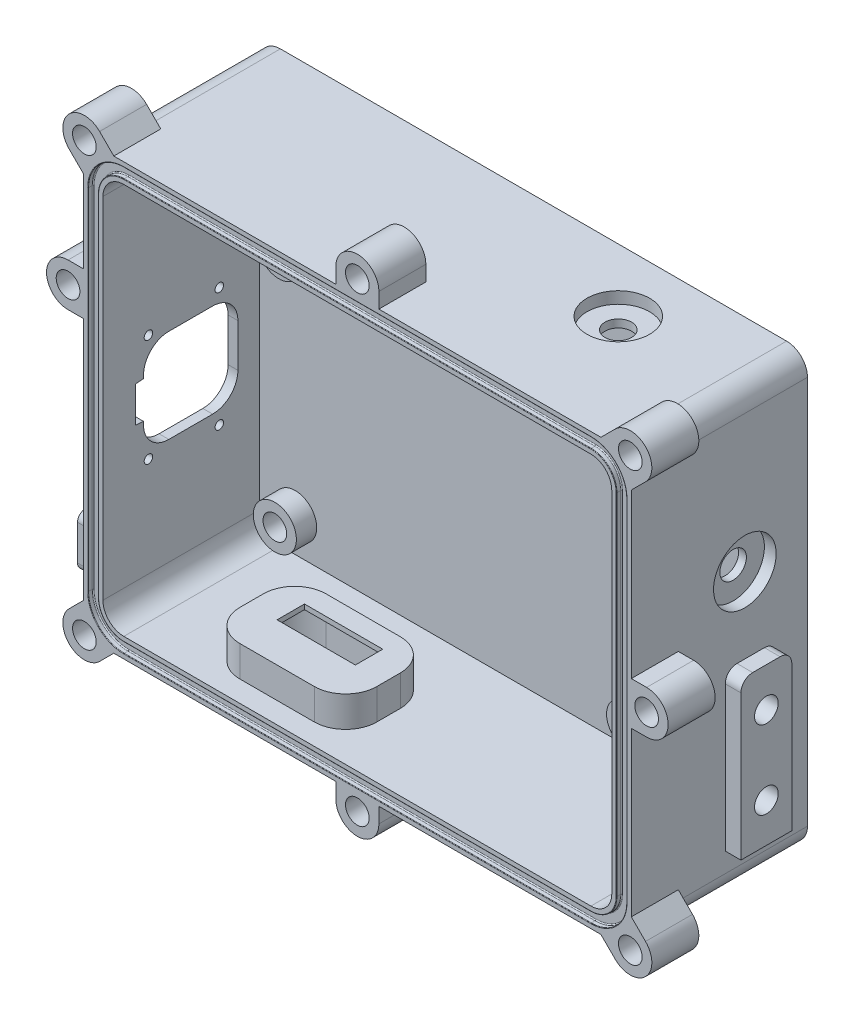
from build123d import *

# Parameters (mm, degrees)
SKETCH1_W               = 130
SKETCH1_H               = 100
BOSS_EXTRUDE1_DEPTH     = 40
SHELL1_T                = 5
FILLET1_R               = 5.334
FILLET2_R               = 5.334
CUT_EXTRUDE1_DEPTH      = 1.2954
FILLET3_R               = 0.254
FILLET4_R               = 0.127
BOSS_EXTRUDE2_START     = -12
BOSS_EXTRUDE2_DEPTH     = 12
SKETCH4_R               = 3.025
CUT_EXTRUDE2_DEPTH      = 9
MIRROR2_START           = -12
MIRROR2_COPY_1_DEPTH    = 12
MIRROR2_COPY_2_SKETCH_R = 3.025
MIRROR2_COPY_2_DEPTH    = 9
BOSS_EXTRUDE4_DEPTH     = 12
SKETCH8_R               = 3.025
CUT_EXTRUDE4_DEPTH      = 9
SKETCH9_R               = 5.5
SKETCH9_R_2             = 3.025
BOSS_EXTRUDE5_DEPTH     = 5.2
BOSS_EXTRUDE6_START     = -12
BOSS_EXTRUDE6_DEPTH     = 12
SKETCH11_R              = 3.025
CUT_EXTRUDE5_DEPTH      = 9
BOSS_EXTRUDE7_DEPTH     = 4
CUT_EXTRUDE6_START      = -6.5
SKETCH13_R              = 3.025
CUT_EXTRUDE6_DEPTH      = 6.5
FILLET5_R               = 2
FILLET6_R               = 3
SKETCH14_W              = 13
SKETCH14_H              = 40
SKETCH14_R              = 3.025
BOSS_EXTRUDE8_DEPTH     = 4
CUT_EXTRUDE7_START      = -6.5
SKETCH15_R              = 3.025
CUT_EXTRUDE7_DEPTH      = 6.5
FILLET7_R               = 3
SKETCH16_R              = 3.4
CUT_EXTRUDE8_DEPTH      = 5
SKETCH17_R              = 8
CUT_EXTRUDE9_DEPTH      = 3
SKETCH18_R              = 3.4
CUT_EXTRUDE10_DEPTH     = 5
SKETCH19_R              = 8
CUT_EXTRUDE11_DEPTH     = 3
SKETCH20_W              = 20
SKETCH20_H              = 7
CUT_EXTRUDE12_DEPTH     = 5
SKETCH21_W              = 35
SKETCH21_H              = 22
BOSS_EXTRUDE9_DEPTH     = 12.85
SKETCH22_W              = 32.5
SKETCH22_H              = 19.5
SKETCH22_W_2            = 20
SKETCH22_H_2            = 7
CUT_EXTRUDE14_DEPTH     = 11.6
SKETCH24_R              = 1.085
CUT_EXTRUDE16_DEPTH     = 5
CUT_EXTRUDE17_DEPTH     = 2.5
FILLET8_R               = 8
FILLET9_R               = 8


# Read off the part's stored shape, not the designer's step: Boss-Extrude6
with BuildPart() as part:
    # Sketch1 → Boss-Extrude1 (new body)
    with BuildSketch(Plane.XY):
        Rectangle(SKETCH1_W, SKETCH1_H)
    extrude(amount=BOSS_EXTRUDE1_DEPTH)

    # Shell1
    shell1_openings = [part.faces().sort_by_distance(p)[0] for p in [
        (0, 0, 40),
    ]]
    offset(amount=SHELL1_T, openings=shell1_openings, kind=Kind.INTERSECTION)

    # Fillet1
    # the kernel refuses this fillet: 5.334 mm, written as the material it adds along each edge
    with BuildSketch(Plane(origin=(65, -50, 0), x_dir=(0, 1, 0), z_dir=(0, 0, 1)), Plane(origin=(65, 50, 0), x_dir=(-1, 0, 0), z_dir=(0, 0, 1)), Plane(origin=(-65, -50, 0), x_dir=(1, 0, 0), z_dir=(0, 0, 1))) as fillet1_piece_1:
        with BuildLine():
            CenterArc((FILLET1_R, FILLET1_R), FILLET1_R, 180, 90)
            Line((0, FILLET1_R), (0, 0))
            Line((0, 0), (FILLET1_R, 0))
        make_face()
    extrude(amount=40)
    with BuildSketch(Plane(origin=(-65, 50, 0), x_dir=(1, 0, 0), z_dir=(0, 0, 1))) as fillet1_piece_2:
        with BuildLine():
            CenterArc((FILLET1_R, -FILLET1_R), FILLET1_R, 90, 90)
            Line((0, -FILLET1_R), (0, 0))
            Line((0, 0), (FILLET1_R, 0))
        make_face()
    extrude(amount=40)

    # Fillet2
    fillet2_edges = [part.edges().sort_by_distance(p)[0] for p in [
        (70, -55, 17.5),
        (-70, -55, 17.5),
        (-70, 55, 17.5),
        (70, 55, 17.5),
    ]]
    fillet(fillet2_edges, radius=FILLET2_R)

    # Sketch2 → Cut-Extrude1 (cut)
    with BuildSketch(Plane.XY.offset(40)):
        with BuildLine():
            Line((59.666, 53.7827), (-59.666, 53.7827))
            ThreePointArc((-59.666, 53.7827), (-66.112480392, 51.112480392), (-68.7827, 44.666))
            Line((-68.7827, 44.666), (-68.7827, -44.666))
            ThreePointArc((-68.7827, -44.666), (-66.112480392, -51.112480392), (-59.666, -53.7827))
            Line((-59.666, -53.7827), (59.666, -53.7827))
            ThreePointArc((59.666, -53.7827), (66.112480392, -51.112480392), (68.7827, -44.666))
            Line((68.7827, -44.666), (68.7827, 44.666))
            ThreePointArc((68.7827, 44.666), (66.112480392, 51.112480392), (59.666, 53.7827))
        make_face()
        with BuildLine():
            Line((-66.2173, 44.666), (-66.2173, -44.666))
            ThreePointArc((-66.2173, -44.666), (-64.298468656, -49.298468656), (-59.666, -51.2173))
            Line((-59.666, -51.2173), (59.666, -51.2173))
            ThreePointArc((59.666, -51.2173), (64.298468656, -49.298468656), (66.2173, -44.666))
            Line((66.2173, -44.666), (66.2173, 44.666))
            ThreePointArc((66.2173, 44.666), (64.298468656, 49.298468656), (59.666, 51.2173))
            Line((59.666, 51.2173), (-59.666, 51.2173))
            ThreePointArc((-59.666, 51.2173), (-64.298468656, 49.298468656), (-66.2173, 44.666))
        make_face(mode=Mode.SUBTRACT)
    extrude(amount=-CUT_EXTRUDE1_DEPTH, mode=Mode.SUBTRACT)

    # Fillet3
    fillet3_edges = [part.edges().sort_by_distance(p)[0] for p in [
        (66.112480392, 51.112480392, 38.7046),
        (68.7827, 0, 38.7046),
        (66.112480392, -51.112480392, 38.7046),
        (0, -53.7827, 38.7046),
        (-66.112480392, -51.112480392, 38.7046),
        (-68.7827, 0, 38.7046),
        (-66.112480392, 51.112480392, 38.7046),
        (0, 53.7827, 38.7046),
        (0, 51.2173, 38.7046),
        (-64.298468656, 49.298468656, 38.7046),
        (-66.2173, 0, 38.7046),
        (-64.298468656, -49.298468656, 38.7046),
        (0, -51.2173, 38.7046),
        (64.298468656, -49.298468656, 38.7046),
        (66.2173, 0, 38.7046),
        (64.298468656, 49.298468656, 38.7046),
    ]]
    fillet(fillet3_edges, radius=FILLET3_R)

    # Fillet4
    fillet4_edges = [part.edges().sort_by_distance(p)[0] for p in [
        (66.112480392, 51.112480392, 40),
        (0, 53.7827, 40),
        (-66.112480392, 51.112480392, 40),
        (-68.7827, 0, 40),
        (-66.112480392, -51.112480392, 40),
        (0, -53.7827, 40),
        (66.112480392, -51.112480392, 40),
        (68.7827, 0, 40),
        (-64.298468656, 49.298468656, 40),
        (0, 51.2173, 40),
        (64.298468656, 49.298468656, 40),
        (66.2173, 0, 40),
        (64.298468656, -49.298468656, 40),
        (0, -51.2173, 40),
        (-64.298468656, -49.298468656, 40),
        (-66.2173, 0, 40),
    ]]
    fillet(fillet4_edges, radius=FILLET4_R)

    # Sketch3 → Boss-Extrude2 (add)
    with BuildSketch(Plane.XY.offset(40).offset(BOSS_EXTRUDE2_START)):
        with BuildLine():
            Line((70, -47.221825407), (70, -49.666))
            ThreePointArc((70, -49.666), (69.593973426, -51.707233428), (68.437707571, -53.437707571))
            ThreePointArc((68.437707571, -53.437707571), (66.707233428, -54.593973426), (64.666, -55))
            Line((64.666, -55), (62.221825407, -55))
            Line((62.221825407, -55), (65.848729563, -58.626904156))
            ThreePointArc((65.848729563, -58.626904156), (73.626904156, -58.626904156), (73.626904156, -50.848729563))
            Line((73.626904156, -50.848729563), (70, -47.221825407))
        make_face()
    boss_extrude2 = extrude(amount=BOSS_EXTRUDE2_DEPTH)

    # Sketch4 → Cut-Extrude2 (cut)
    with BuildSketch(Plane.XY.offset(40)):
        with Locations((69.737816859, -54.737816859)):
            Circle(SKETCH4_R)
    cut_extrude2 = extrude(amount=-CUT_EXTRUDE2_DEPTH, mode=Mode.SUBTRACT)

    # Mirror1: Boss-Extrude2, Cut-Extrude2 across plane
    add(boss_extrude2.mirror(Plane.ZX))
    add(cut_extrude2.mirror(Plane.ZX), mode=Mode.SUBTRACT)

    # Mirror2: Boss-Extrude2, Cut-Extrude2 across plane
    add(boss_extrude2.mirror(Plane(origin=(0, 0, 0), x_dir=(0, 0, 1), z_dir=(1, 0, 0))))
    add(cut_extrude2.mirror(Plane(origin=(0, 0, 0), x_dir=(0, 0, 1), z_dir=(1, 0, 0))), mode=Mode.SUBTRACT)

    # Mirror2 copy 1 sketch → Mirror2 copy 1 (add)
    with BuildSketch(Plane(origin=(0, 0, 40), x_dir=(-1, 0, 0), z_dir=(0, 0, 1)).offset(MIRROR2_START)):
        with BuildLine():
            Line((70, -47.221825407), (70, -49.666))
            ThreePointArc((70, -49.666), (69.593973426, -51.707233428), (68.437707571, -53.437707571))
            ThreePointArc((68.437707571, -53.437707571), (66.707233428, -54.593973426), (64.666, -55))
            Line((64.666, -55), (62.221825407, -55))
            Line((62.221825407, -55), (65.848729563, -58.626904156))
            ThreePointArc((65.848729563, -58.626904156), (73.626904156, -58.626904156), (73.626904156, -50.848729563))
            Line((73.626904156, -50.848729563), (70, -47.221825407))
        make_face()
    extrude(amount=MIRROR2_COPY_1_DEPTH)

    # Mirror2 copy 2 sketch → Mirror2 copy 2 (cut)
    with BuildSketch(Plane(origin=(0, 0, 40), x_dir=(-1, 0, 0), z_dir=(0, 0, 1))):
        with Locations((69.737816859, -54.737816859)):
            Circle(MIRROR2_COPY_2_SKETCH_R)
    extrude(amount=-MIRROR2_COPY_2_DEPTH, mode=Mode.SUBTRACT)

    # Sketch7 → Boss-Extrude4 (add)
    with BuildSketch(Plane.XY.offset(40)):
        with BuildLine():
            Line((5.5, 55), (5.5, 58.9097))
            ThreePointArc((5.5, 58.9097), (0, 64.4097), (-5.5, 58.9097))
            Line((-5.5, 58.9097), (-5.5, 55))
            Line((-5.5, 55), (5.5, 55))
        make_face()
    boss_extrude4 = extrude(amount=-BOSS_EXTRUDE4_DEPTH)

    # Sketch8 → Cut-Extrude4 (cut)
    with BuildSketch(Plane.XY.offset(40)):
        with Locations((0, 58.9097)):
            Circle(SKETCH8_R)
    cut_extrude4 = extrude(amount=-CUT_EXTRUDE4_DEPTH, mode=Mode.SUBTRACT)

    # Mirror4: Boss-Extrude4, Cut-Extrude4 across plane
    add(boss_extrude4.mirror(Plane.ZX))
    add(cut_extrude4.mirror(Plane.ZX), mode=Mode.SUBTRACT)

    # Sketch9 → Boss-Extrude5 (add)
    # profile 1 of 4: a face of its own
    with BuildSketch(Plane.XY):
        with Locations((34.547117801, 20.643500183)):
            Circle(SKETCH9_R)
        with Locations((34.547117801, 20.643500183)):
            Circle(SKETCH9_R_2, mode=Mode.SUBTRACT)
    # profile 2 of 4: a face of its own
    with BuildSketch(Plane.XY):
        with Locations((34.365117801, -40.315499817)):
            Circle(SKETCH9_R)
        with Locations((34.365117801, -40.315499817)):
            Circle(SKETCH9_R_2, mode=Mode.SUBTRACT)
    # profile 3 of 4: a face of its own
    with BuildSketch(Plane.XY):
        with Locations((-55.876882199, -41.332499817)):
            Circle(SKETCH9_R)
        with Locations((-55.876882199, -41.332499817)):
            Circle(SKETCH9_R_2, mode=Mode.SUBTRACT)
    # profile 4 of 4: a face of its own
    with BuildSketch(Plane.XY):
        with Locations((-54.860882199, 19.627500183)):
            Circle(SKETCH9_R)
        with Locations((-54.860882199, 19.627500183)):
            Circle(SKETCH9_R_2, mode=Mode.SUBTRACT)
    extrude(amount=BOSS_EXTRUDE5_DEPTH)

    # Boss-Extrude6 outline → Boss-Extrude6 (add)
    with BuildSketch(Plane.XY.offset(40).offset(BOSS_EXTRUDE6_START)):
        with BuildLine():
            ThreePointArc((73.9097, -5.5), (79.4097, 0), (73.9097, 5.5))
            Line((73.9097, 5.5), (70, 5.5))
            Line((70, 5.5), (70, -5.5))
            Line((70, -5.5), (73.9097, -5.5))
        make_face()
        with BuildLine():
            Line((-70, 26.166), (-73.9097, 26.166))
            ThreePointArc((-73.9097, 26.166), (-79.4097, 20.666), (-73.9097, 15.166))
            Line((-73.9097, 15.166), (-70, 15.166))
            Line((-70, 15.166), (-70, 26.166))
        make_face()
    extrude(amount=BOSS_EXTRUDE6_DEPTH)

    # Sketch11 → Cut-Extrude5 (cut)
    with BuildSketch(Plane.XY.offset(40)):
        with Locations((-73.9097, 20.666)):
            Circle(SKETCH11_R)
        with Locations((73.9097, 0)):
            Circle(SKETCH11_R)
    extrude(amount=-CUT_EXTRUDE5_DEPTH, mode=Mode.SUBTRACT)

    # Sketch12 → Boss-Extrude7 (add)
    with BuildSketch(Plane.ZY.offset(70)):
        with BuildLine():
            Line((30.525, -37.666), (37.5, -37.666))
            Line((37.5, -37.666), (37.5, -31.166))
            Line((37.5, -31.166), (-2.5, -31.166))
            Line((-2.5, -31.166), (-2.5, -37.666))
            Line((-2.5, -37.666), (4.475, -37.666))
            ThreePointArc((4.475, -37.666), (7.5, -34.641), (10.525, -37.666))
            Line((10.525, -37.666), (17.5, -37.666))
            Line((17.5, -37.666), (24.475, -37.666))
            ThreePointArc((24.475, -37.666), (27.5, -34.641), (30.525, -37.666))
        make_face()
        with BuildLine():
            Line((-2.5, -44.166), (37.5, -44.166))
            Line((37.5, -44.166), (37.5, -37.666))
            Line((37.5, -37.666), (30.525, -37.666))
            ThreePointArc((30.525, -37.666), (27.5, -40.691), (24.475, -37.666))
            Line((24.475, -37.666), (17.5, -37.666))
            Line((17.5, -37.666), (10.525, -37.666))
            ThreePointArc((10.525, -37.666), (7.5, -40.691), (4.475, -37.666))
            Line((4.475, -37.666), (-2.5, -37.666))
            Line((-2.5, -37.666), (-2.5, -44.166))
        make_face()
    extrude(amount=BOSS_EXTRUDE7_DEPTH)

    # Sketch13 → Cut-Extrude6 (cut)
    with BuildSketch(Plane.ZY.offset(74).offset(CUT_EXTRUDE6_START)):
        with Locations(Location((27.5, -37.666, 0), (0, 0, 270))):
            Circle(SKETCH13_R)
        with Locations(Location((7.5, -37.666, 0), (0, 0, 270))):
            Circle(SKETCH13_R)
    extrude(amount=CUT_EXTRUDE6_DEPTH, mode=Mode.SUBTRACT)

    # Fillet5
    fillet5_edges = [part.edges().sort_by_distance(p)[0] for p in [
        (-72, -44.166, 37.5),
        (-72, -31.166, 37.5),
    ]]
    fillet(fillet5_edges, radius=FILLET5_R)

    # Fillet6
    fillet6_edges = [part.edges().sort_by_distance(p)[0] for p in [
        (-72, -31.166, -2.5),
    ]]
    fillet(fillet6_edges, radius=FILLET6_R)

    # Sketch14 → Boss-Extrude8 (add)
    with BuildSketch(Plane(origin=(70, 0, 0), x_dir=(0, 0, -1), z_dir=(1, 0, 0))):
        with Locations((-9.5, -24.666)):
            Rectangle(SKETCH14_W, SKETCH14_H)
        with Locations(Location((-9.5, -34.666, 0), (0, 0, 90))):
            Circle(SKETCH14_R, mode=Mode.SUBTRACT)
        with Locations(Location((-9.5, -14.666, 0), (0, 0, 90))):
            Circle(SKETCH14_R, mode=Mode.SUBTRACT)
    extrude(amount=BOSS_EXTRUDE8_DEPTH)

    # Sketch15 → Cut-Extrude7 (cut)
    with BuildSketch(Plane(origin=(74, 0, 0), x_dir=(0, 0, -1), z_dir=(1, 0, 0)).offset(CUT_EXTRUDE7_START)):
        with Locations(Location((-9.5, -14.666, 0), (0, 0, 90))):
            Circle(SKETCH15_R)
        with Locations(Location((-9.5, -34.666, 0), (0, 0, 90))):
            Circle(SKETCH15_R)
    extrude(amount=CUT_EXTRUDE7_DEPTH, mode=Mode.SUBTRACT)

    # Fillet7
    fillet7_edges = [part.edges().sort_by_distance(p)[0] for p in [
        (72, -4.666, 3),
        (72, -4.666, 16),
    ]]
    fillet(fillet7_edges, radius=FILLET7_R)

    # Sketch16 → Cut-Extrude8 (cut)
    with BuildSketch(Plane(origin=(0, 55, 0), x_dir=(1, 0, 0), z_dir=(0, 1, 0))):
        with Locations(Location((37.666, -11, 0), (0, 0, 270))):
            Circle(SKETCH16_R)
    extrude(amount=-CUT_EXTRUDE8_DEPTH, mode=Mode.SUBTRACT)

    # Sketch17 → Cut-Extrude9 (cut)
    with BuildSketch(Plane(origin=(0, 55, 0), x_dir=(1, 0, 0), z_dir=(0, 1, 0))):
        with Locations(Location((37.666, -11, 0), (0, 0, 270))):
            Circle(SKETCH17_R)
    extrude(amount=-CUT_EXTRUDE9_DEPTH, mode=Mode.SUBTRACT)

    # Sketch18 → Cut-Extrude10 (cut)
    with BuildSketch(Plane(origin=(70, 0, 0), x_dir=(0, 0, -1), z_dir=(1, 0, 0))):
        with Locations(Location((-11, 14.666, 0), (0, 0, 90))):
            Circle(SKETCH18_R)
    extrude(amount=-CUT_EXTRUDE10_DEPTH, mode=Mode.SUBTRACT)

    # Sketch19 → Cut-Extrude11 (cut)
    with BuildSketch(Plane(origin=(70, 0, 0), x_dir=(0, 0, -1), z_dir=(1, 0, 0))):
        with Locations(Location((-11, 14.666, 0), (0, 0, 90))):
            Circle(SKETCH19_R)
    extrude(amount=-CUT_EXTRUDE11_DEPTH, mode=Mode.SUBTRACT)

    # Sketch20 → Cut-Extrude12 (cut)
    with BuildSketch(Plane.XZ.offset(55)):
        with Locations((-25.904879453, 21.1017224)):
            Rectangle(SKETCH20_W, SKETCH20_H)
    extrude(amount=-CUT_EXTRUDE12_DEPTH, mode=Mode.SUBTRACT)

    # Sketch21 → Boss-Extrude9 (add)
    with BuildSketch(Plane.XZ.offset(55)):
        with Locations((-25.904879453, 23.6017224)):
            Rectangle(SKETCH21_W, SKETCH21_H)
        Polygon((-25.904879453, 17.6017224), (-35.904879453, 17.6017224), (-35.904879453, 24.6017224), (-15.904879453, 24.6017224), (-15.904879453, 17.6017224), align=None, mode=Mode.SUBTRACT)
    extrude(amount=-BOSS_EXTRUDE9_DEPTH)

    # Sketch22 → Cut-Extrude14 (cut)
    with BuildSketch(Plane.XZ.offset(55)):
        with Locations((-25.904879453, 23.6017224)):
            Rectangle(SKETCH22_W, SKETCH22_H)
        with Locations((-25.904879453, 21.1017224)):
            Rectangle(SKETCH22_W_2, SKETCH22_H_2, mode=Mode.SUBTRACT)
    extrude(amount=-CUT_EXTRUDE14_DEPTH, mode=Mode.SUBTRACT)

    # Sketch24 → Cut-Extrude16 (cut)
    with BuildSketch(Plane.ZY.offset(70)):
        with BuildLine():
            Line((29.625151316, -0.812709335), (29.625151316, -0.045457453))
            ThreePointArc((29.625151316, -0.045457453), (27.734818482, 4.518209713), (23.171151316, 6.408542547))
            Line((23.171151316, 6.408542547), (11.971151316, 6.408542547))
            ThreePointArc((11.971151316, 6.408542547), (7.40748415, 4.518209713), (5.517151316, -0.045457453))
            Line((5.517151316, -0.045457453), (5.517151316, -11.045457453))
            ThreePointArc((5.517151316, -11.045457453), (7.40748415, -15.609124618), (11.971151316, -17.499457453))
            Line((11.971151316, -17.499457453), (23.171151316, -17.499457453))
            ThreePointArc((23.171151316, -17.499457453), (27.734818482, -15.609124618), (29.625151316, -11.045457453))
            Line((29.625151316, -11.045457453), (29.625151316, -10.278205571))
            Line((29.625151316, -10.278205571), (31.625151465, -10.103228199))
            Line((31.625151465, -10.103228199), (31.625151465, -0.987686614))
            Line((31.625151465, -0.987686614), (29.625151316, -0.812709335))
        make_face()
        with Locations(Location((10.271152135, -20.745457229, 0), (0, 0, 270))):
            Circle(SKETCH24_R)
        with Locations(Location((10.271152135, 9.654542771, 0), (0, 0, 270))):
            Circle(SKETCH24_R)
        with Locations(Location((28.371152135, -19.245457229, 0), (0, 0, 270))):
            Circle(SKETCH24_R)
        with Locations(Location((28.371152135, 8.154542771, 0), (0, 0, 270))):
            Circle(SKETCH24_R)
    extrude(amount=-CUT_EXTRUDE16_DEPTH, mode=Mode.SUBTRACT)

    # Sketch25 → Cut-Extrude17 (cut)
    with BuildSketch(Plane.ZY.offset(70)):
        with BuildLine():
            Line((35.033651838, -19.83295731), (35.033651838, 8.74204269))
            ThreePointArc((35.033651838, 8.74204269), (33.173779899, 13.232170751), (28.683651838, 15.09204269))
            Line((28.683651838, 15.09204269), (6.458651838, 15.09204269))
            ThreePointArc((6.458651838, 15.09204269), (1.968523778, 13.232170751), (0.108651838, 8.74204269))
            Line((0.108651838, 8.74204269), (0.108651838, -19.83295731))
            ThreePointArc((0.108651838, -19.83295731), (1.968523778, -24.323085371), (6.458651838, -26.18295731))
            Line((6.458651838, -26.18295731), (28.683651838, -26.18295731))
            ThreePointArc((28.683651838, -26.18295731), (33.173779899, -24.323085371), (35.033651838, -19.83295731))
        make_face()
    extrude(amount=-CUT_EXTRUDE17_DEPTH, mode=Mode.SUBTRACT)

    # Fillet8
    fillet8_edges = [part.edges().sort_by_distance(p)[0] for p in [
        (-8.404879453, -46.075, 34.6017224),
        (-8.404879453, -46.075, 12.6017224),
        (-43.404879453, -46.075, 12.6017224),
        (-43.404879453, -46.075, 34.6017224),
    ]]
    fillet(fillet8_edges, radius=FILLET8_R)

    # Fillet9
    fillet9_edges = [part.edges().sort_by_distance(p)[0] for p in [
        (-9.654879453, -49.2, 33.3517224),
        (-9.654879453, -49.2, 13.8517224),
        (-42.154879453, -49.2, 13.8517224),
        (-42.154879453, -49.2, 33.3517224),
    ]]
    fillet(fillet9_edges, radius=FILLET9_R)


solid = part.part
